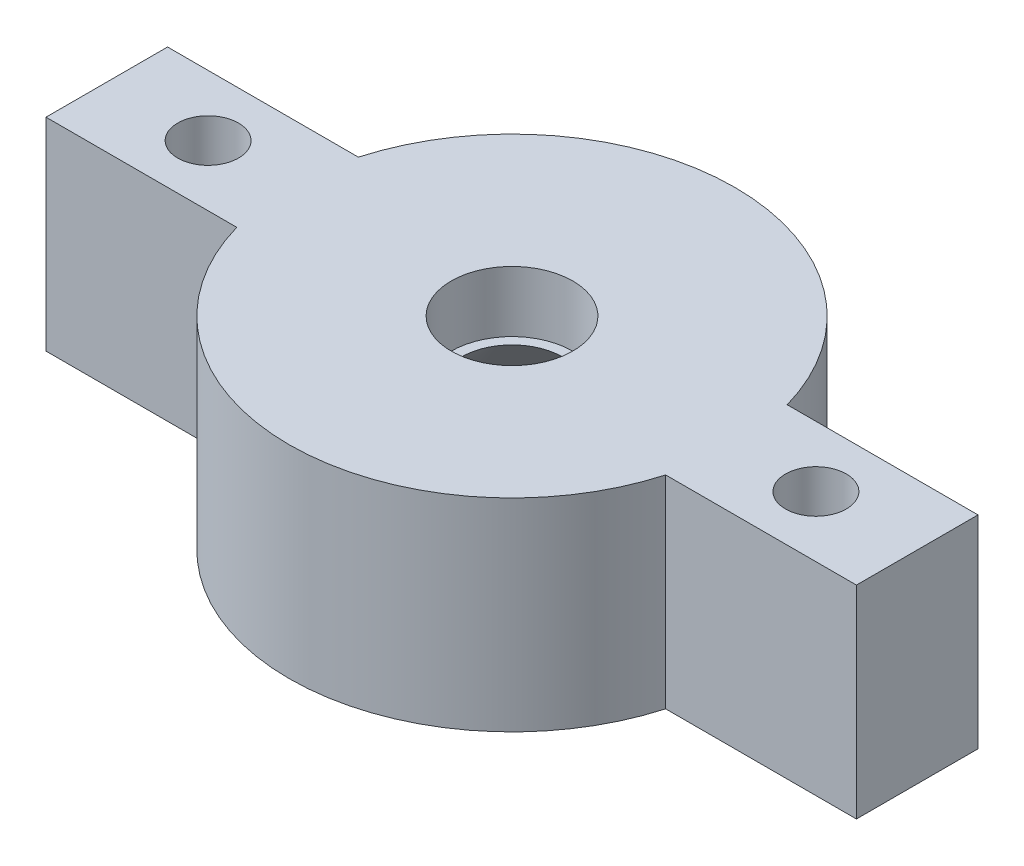
from build123d import *

# Parameters (mm, degrees)
SKETCH2_W           = 6
SKETCH2_H           = 10
BOSS_EXTRUDE1_DEPTH = 40
SKETCH3_R           = 11
BOSS_EXTRUDE2_DEPTH = 10
SKETCH4_R           = 7.5
CUT_EXTRUDE1_DEPTH  = 2
SKETCH6_R           = 3
CUT_EXTRUDE2_DEPTH  = 13
FILLET1_R           = 2
CUT_EXTRUDE3_REACH  = 44.673
SKETCH7_R           = 1.5


with BuildPart() as part:
    # Sketch2 → Boss-Extrude1 (new body)
    with BuildSketch(Plane(origin=(0, 0, 0), x_dir=(0, 0, -1), z_dir=(1, 0, 0))):
        Rectangle(SKETCH2_W, SKETCH2_H)
    extrude(amount=BOSS_EXTRUDE1_DEPTH)

    # Sketch3 → Boss-Extrude2 (add)
    with BuildSketch(Plane(origin=(0, 5, 0), x_dir=(1, 0, 0), z_dir=(0, 1, 0))):
        with Locations((20, 0)):
            Circle(SKETCH3_R)
    extrude(amount=-BOSS_EXTRUDE2_DEPTH)

    # Sketch4 → Cut-Extrude1 (cut)
    with BuildSketch(Plane(origin=(0, -5, 0), x_dir=(-1, 0, 0), z_dir=(0, -1, 0))):
        with Locations(Location((-20, 0, 0), (0, 0, 90))):
            Circle(SKETCH4_R)
    extrude(amount=-CUT_EXTRUDE1_DEPTH, mode=Mode.SUBTRACT)

    # Sketch5 → Cut-Revolve1 (revolve, cut)
    with BuildSketch(Plane(origin=(0, 0, 0), x_dir=(-1, 0, 0), z_dir=(0, 0, -1)), mode=Mode.PRIVATE) as cut_revolve1_sk:
        Polygon((-20, -3), (-27.5, -3), (-22.5, 2), (-20, 2), align=None)
    revolve(cut_revolve1_sk.sketch.rotate(Axis((20, 2, 0), (0, -1, 0)), 270), axis=Axis((20, 2, 0), (0, -1, 0)), mode=Mode.SUBTRACT)

    # Sketch6 → Cut-Extrude2 (cut)
    with BuildSketch(Plane.XZ.offset(-2)):
        with Locations(Location((20, 0, 0), (0, 0, 270))):
            Circle(SKETCH6_R)
    extrude(amount=-CUT_EXTRUDE2_DEPTH, mode=Mode.SUBTRACT)

    # Fillet1
    fillet1_edges = [part.edges().sort_by_distance(p)[0] for p in [
        (20, -5, 7.5),
    ]]
    fillet(fillet1_edges, radius=FILLET1_R - 0.0001)  # a hair under: the kernel refuses the full size

    # Sketch7 → Cut-Extrude3 (cut, up to next)
    with BuildSketch(Plane.XZ.offset(5), mode=Mode.PRIVATE) as cut_extrude3_sk1:
        with Locations(Location((5, 0, 0), (0, 0, 270))):
            Circle(SKETCH7_R)
    cut_extrude3_tool1 = extrude(cut_extrude3_sk1.sketch, amount=-CUT_EXTRUDE3_REACH, mode=Mode.PRIVATE) & part.part
    # Sketch7 → Cut-Extrude3 (cut, up to next)
    with BuildSketch(Plane.XZ.offset(5), mode=Mode.PRIVATE) as cut_extrude3_sk2:
        with Locations(Location((35, 0, 0), (0, 0, 270))):
            Circle(SKETCH7_R)
    cut_extrude3_tool2 = extrude(cut_extrude3_sk2.sketch, amount=-CUT_EXTRUDE3_REACH, mode=Mode.PRIVATE) & part.part
    add(cut_extrude3_tool1.solids().sort_by_distance((5, -5, 0))[0], mode=Mode.SUBTRACT)
    add(cut_extrude3_tool2.solids().sort_by_distance((35, -5, 0))[0], mode=Mode.SUBTRACT)


solid = part.part
